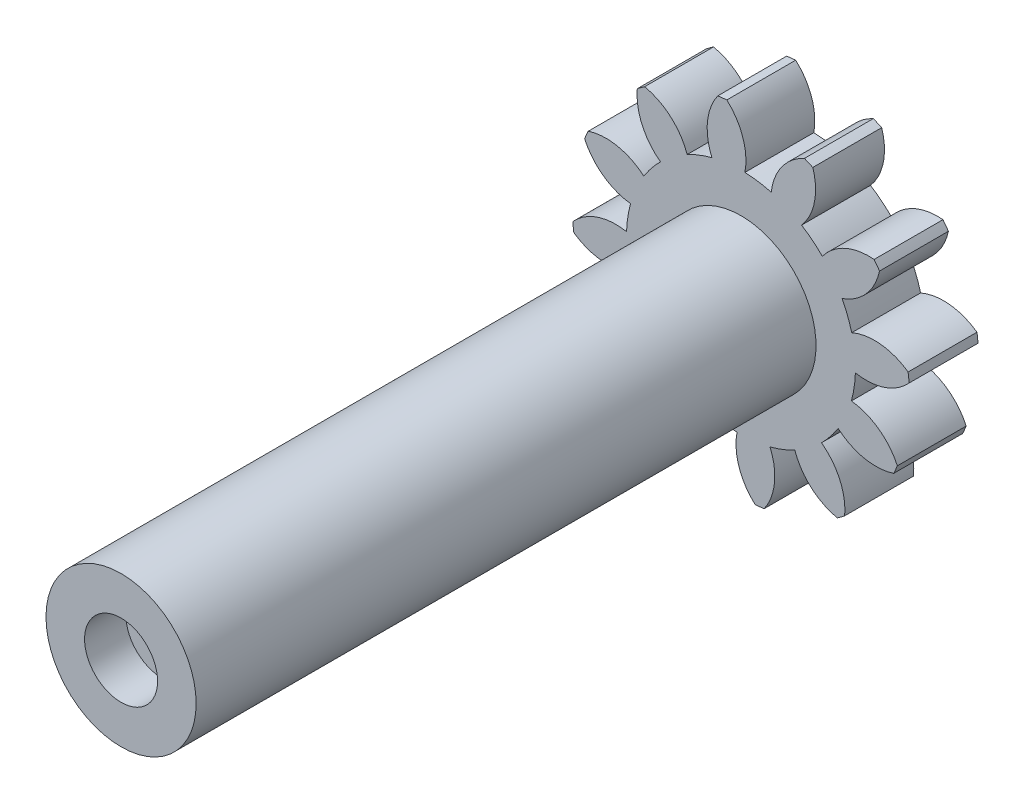
from build123d import *

# Parameters (mm, degrees)
SKETCH1_R           = 5.45
BOSS_EXTRUDE1_DEPTH = 50
SKETCH6_R           = 2.5
BOSS_EXTRUDE2_DEPTH = 2.5
SKETCH7_R           = 2.65
CUT_EXTRUDE1_DEPTH  = 3
JOIN1_DEPTH         = 5


# Read off the part's stored shape, not the designer's step: Join1
with BuildPart() as part:
    # Sketch1 → Boss-Extrude1 (new body)
    with BuildSketch(Plane.XY):
        Circle(SKETCH1_R)
    extrude(amount=BOSS_EXTRUDE1_DEPTH)

    # Sketch6 → Boss-Extrude2 (add)
    with BuildSketch(Plane(origin=(0, 0, 0), x_dir=(-1, 0, 0), z_dir=(0, 0, -1))):
        Circle(SKETCH6_R)
    extrude(amount=BOSS_EXTRUDE2_DEPTH)

    # Sketch7 → Cut-Extrude1 (cut)
    with BuildSketch(Plane.XY.offset(50)):
        Circle(SKETCH7_R)
    extrude(amount=-CUT_EXTRUDE1_DEPTH, mode=Mode.SUBTRACT)

    # Join1 outline → Join1 (add)
    with BuildSketch(Plane.XY):
        with BuildLine():
            ThreePointArc((3.905791733, -7.336608426), (5.093273997, -9.101255459), (6.993020796, -10.05784073))
            ThreePointArc((6.993020796, -10.05784073), (7.262719681, -9.864856959), (7.527095748, -9.664643274))
            ThreePointArc((7.527095748, -9.664643274), (7.177895055, -7.56651264), (5.845552604, -5.908514788))
            ThreePointArc((5.845552604, -5.908514788), (6.492103401, -5.189761622), (7.050819075, -4.400793408))
            ThreePointArc((7.050819075, -4.400793408), (8.961532399, -5.335281436), (11.085054023, -5.213835182))
            ThreePointArc((11.085054023, -5.213835182), (11.222128224, -4.911856891), (11.350977771, -4.60627872))
            ThreePointArc((11.350977771, -4.60627872), (9.999495783, -2.963844637), (8.016654448, -2.194147603))
            ThreePointArc((8.016654448, -2.194147603), (8.21720728, -1.248413703), (8.306585141, -0.28578935))
            ThreePointArc((8.306585141, -0.28578935), (10.428555432, -0.13972306), (12.206855977, 1.027213293))
            ThreePointArc((12.206855977, 1.027213293), (12.174576572, 1.357271264), (12.133374467, 1.686334497))
            ThreePointArc((12.133374467, 1.686334497), (10.141739691, 2.432983143), (8.039700207, 2.10813966))
            ThreePointArc((8.039700207, 2.10813966), (7.740517104, 3.027445658), (7.336608426, 3.905791733))
            ThreePointArc((7.336608426, 3.905791733), (9.101255459, 5.093273997), (10.05784073, 6.993020796))
            ThreePointArc((10.05784073, 6.993020796), (9.864856959, 7.262719681), (9.664643274, 7.527095748))
            ThreePointArc((9.664643274, 7.527095748), (7.56651264, 7.177895055), (5.908514788, 5.845552604))
            ThreePointArc((5.908514788, 5.845552604), (5.189761622, 6.492103401), (4.400793408, 7.050819075))
            ThreePointArc((4.400793408, 7.050819075), (5.335281436, 8.961532399), (5.213835182, 11.085054023))
            ThreePointArc((5.213835182, 11.085054023), (4.911856891, 11.222128224), (4.60627872, 11.350977771))
            ThreePointArc((4.60627872, 11.350977771), (2.963844637, 9.999495783), (2.194147603, 8.016654448))
            ThreePointArc((2.194147603, 8.016654448), (1.248413703, 8.21720728), (0.28578935, 8.306585141))
            ThreePointArc((0.28578935, 8.306585141), (0.13972306, 10.428555432), (-1.027213293, 12.206855977))
            ThreePointArc((-1.027213293, 12.206855977), (-1.357271264, 12.174576572), (-1.686334497, 12.133374467))
            ThreePointArc((-1.686334497, 12.133374467), (-2.432983143, 10.141739691), (-2.10813966, 8.039700207))
            ThreePointArc((-2.10813966, 8.039700207), (-3.027445658, 7.740517104), (-3.905791733, 7.336608426))
            ThreePointArc((-3.905791733, 7.336608426), (-5.093273997, 9.101255459), (-6.993020796, 10.05784073))
            ThreePointArc((-6.993020796, 10.05784073), (-7.262719681, 9.864856959), (-7.527095748, 9.664643274))
            ThreePointArc((-7.527095748, 9.664643274), (-7.177895055, 7.56651264), (-5.845552604, 5.908514788))
            ThreePointArc((-5.845552604, 5.908514788), (-6.492103401, 5.189761622), (-7.050819075, 4.400793408))
            ThreePointArc((-7.050819075, 4.400793408), (-8.961532399, 5.335281436), (-11.085054023, 5.213835182))
            ThreePointArc((-11.085054023, 5.213835182), (-11.222128224, 4.911856891), (-11.350977771, 4.60627872))
            ThreePointArc((-11.350977771, 4.60627872), (-9.999495783, 2.963844637), (-8.016654448, 2.194147603))
            ThreePointArc((-8.016654448, 2.194147603), (-8.21720728, 1.248413703), (-8.306585141, 0.28578935))
            ThreePointArc((-8.306585141, 0.28578935), (-10.428555432, 0.13972306), (-12.206855977, -1.027213293))
            ThreePointArc((-12.206855977, -1.027213293), (-12.174576572, -1.357271264), (-12.133374467, -1.686334497))
            ThreePointArc((-12.133374467, -1.686334497), (-10.141739691, -2.432983143), (-8.039700207, -2.10813966))
            ThreePointArc((-8.039700207, -2.10813966), (-7.740517104, -3.027445658), (-7.336608426, -3.905791733))
            ThreePointArc((-7.336608426, -3.905791733), (-9.101255459, -5.093273997), (-10.05784073, -6.993020796))
            ThreePointArc((-10.05784073, -6.993020796), (-9.864856959, -7.262719681), (-9.664643274, -7.527095748))
            ThreePointArc((-9.664643274, -7.527095748), (-7.56651264, -7.177895055), (-5.908514788, -5.845552604))
            ThreePointArc((-5.908514788, -5.845552604), (-5.189761622, -6.492103401), (-4.400793408, -7.050819075))
            ThreePointArc((-4.400793408, -7.050819075), (-5.335281436, -8.961532399), (-5.213835182, -11.085054023))
            ThreePointArc((-5.213835182, -11.085054023), (-4.911856891, -11.222128224), (-4.60627872, -11.350977771))
            ThreePointArc((-4.60627872, -11.350977771), (-2.963844637, -9.999495783), (-2.194147603, -8.016654448))
            ThreePointArc((-2.194147603, -8.016654448), (-1.248413703, -8.21720728), (-0.28578935, -8.306585141))
            ThreePointArc((-0.28578935, -8.306585141), (-0.13972306, -10.428555432), (1.027213293, -12.206855977))
            ThreePointArc((1.027213293, -12.206855977), (1.357271264, -12.174576572), (1.686334497, -12.133374467))
            ThreePointArc((1.686334497, -12.133374467), (2.432983143, -10.141739691), (2.10813966, -8.039700207))
            ThreePointArc((2.10813966, -8.039700207), (3.027445658, -7.740517104), (3.905791733, -7.336608426))
        make_face()
    extrude(amount=JOIN1_DEPTH)


solid = part.part
